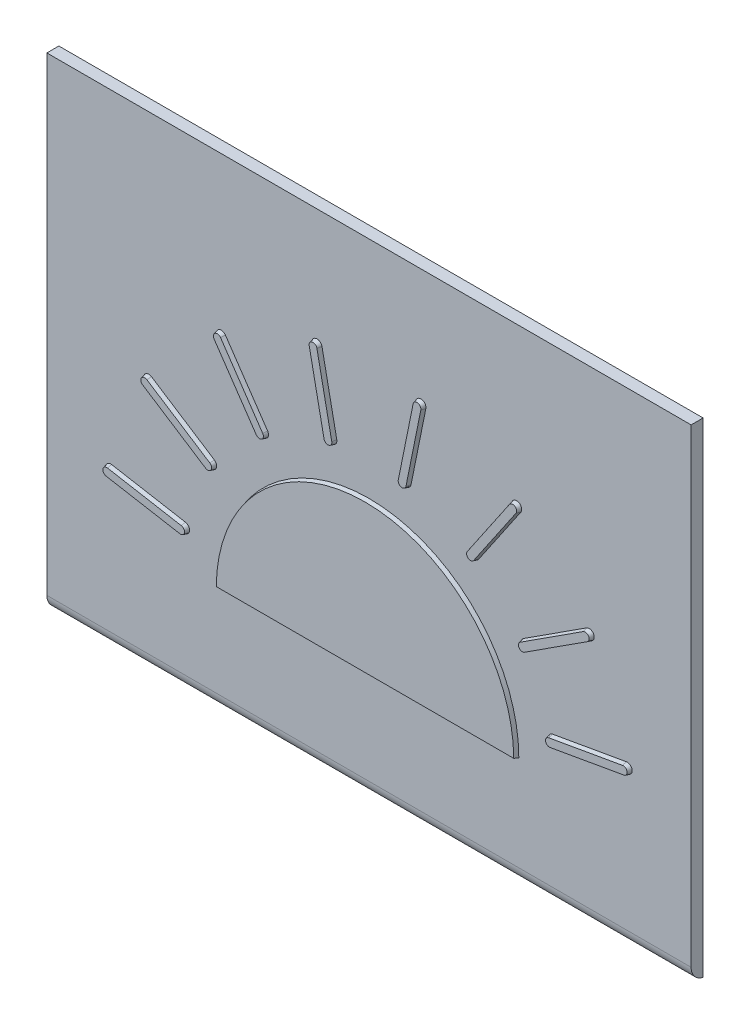
from build123d import *

# Parameters (mm, degrees)
SKETCH1_W                     = 129
SKETCH1_H                     = 97
BOSS_EXTRUDE1_DEPTH           = 2.4
FILLET1_R                     = 3
BOSS_EXTRUDE2_DEPTH           = 0.8
BOSS_EXTRUDE2_DRAFT           = 15
BOSS_EXTRUDE2_PROFILE_2_DEPTH = 0.8
BOSS_EXTRUDE2_PROFILE_2_DRAFT = 15
BOSS_EXTRUDE2_PROFILE_3_DEPTH = 0.8
BOSS_EXTRUDE2_PROFILE_3_DRAFT = 15
BOSS_EXTRUDE2_PROFILE_4_DEPTH = 0.8
BOSS_EXTRUDE2_PROFILE_4_DRAFT = 15
BOSS_EXTRUDE2_PROFILE_5_DEPTH = 0.8
BOSS_EXTRUDE2_PROFILE_5_DRAFT = 15
BOSS_EXTRUDE2_PROFILE_6_DEPTH = 0.8
BOSS_EXTRUDE2_PROFILE_6_DRAFT = 15
BOSS_EXTRUDE2_PROFILE_7_DEPTH = 0.8
BOSS_EXTRUDE2_PROFILE_7_DRAFT = 15
BOSS_EXTRUDE2_PROFILE_8_DEPTH = 0.8
BOSS_EXTRUDE2_PROFILE_8_DRAFT = 15
BOSS_EXTRUDE2_PROFILE_9_DEPTH = 0.8
BOSS_EXTRUDE2_PROFILE_9_DRAFT = 15


with BuildPart() as part:
    # Sketch1 → Boss-Extrude1 (new body)
    with BuildSketch(Plane.XY):
        with Locations((64.5, 48.5)):
            Rectangle(SKETCH1_W, SKETCH1_H)
    extrude(amount=BOSS_EXTRUDE1_DEPTH)

    # Fillet1
    # the kernel refuses this fillet: 3 mm, written as the material it takes off along each edge
    with BuildSketch(Plane(origin=(-7.348469228, 0, 2.4), x_dir=(0, 1.5674498735994488e-12, -1.0), z_dir=(1, 0, 0))) as fillet1_piece_1:
        with BuildLine():
            CenterArc((3, 2.939387691), FILLET1_R, 180, 78.463040967)
            Line((0, 2.939387691), (-0.06, 2.939387691))
            Line((-0.06, 2.939387691), (-0.06, 0))
            Line((-0.06, 0), (0, -0.06))
            ThreePointArc((0, -0.06), (1.2, -0.06), (2.388, -0.058787754))
            Line((2.388, -0.058787754), (2.4, 0))
        make_face()
    extrude(amount=143.696938457, mode=Mode.SUBTRACT)


with BuildPart() as boss_extrude2_tool:
    # Sketch2 → Boss-Extrude2 (with draft: the straight prism first)
    with BuildSketch(Plane.XY.offset(2.4)):
        with BuildLine():
            Line((34.5, 22), (94.5, 22))
            ThreePointArc((94.5, 22), (64.5, 52), (34.5, 22))
        make_face()
    extrude(amount=BOSS_EXTRUDE2_DEPTH)
    # Boss-Extrude2: the draft: its side faces are tilted about the plane it starts from
    boss_extrude2_sides = [boss_extrude2_tool.faces().sort_by_distance(p)[0] for p in [
        (64.5, 22, 2.8),
        (64.5, 52, 2.8),
    ]]
    draft(boss_extrude2_sides, Plane.XY.offset(2.4), BOSS_EXTRUDE2_DRAFT)


with BuildPart() as part_1:
    add(part.part)

    # Boss-Extrude2: add boss_extrude2_tool
    add(boss_extrude2_tool.part)


with BuildPart() as boss_extrude2_profile_2_tool:
    # Sketch2 → Boss-Extrude2 profile 2 (with draft: the straight prism first)
    with BuildSketch(Plane.XY.offset(2.4)):
        with BuildLine():
            ThreePointArc((12.971241145, 32.101337081), (11.812785214, 31.290177505), (12.623944789, 30.131721575))
            Line((12.623944789, 30.131721575), (27.396061084, 27.526998909))
            ThreePointArc((27.396061084, 27.526998909), (28.554517015, 28.338158485), (27.74335744, 29.496614416))
            Line((27.74335744, 29.496614416), (12.971241145, 32.101337081))
        make_face()
    extrude(amount=BOSS_EXTRUDE2_PROFILE_2_DEPTH)
    # Boss-Extrude2 profile 2: the draft: its side faces are tilted about the plane it starts from
    boss_extrude2_profile_2_sides = [boss_extrude2_profile_2_tool.faces().sort_by_distance(p)[0] for p in [
        (11.812785214, 31.290177505, 2.8),
        (20.010002937, 28.829360242, 2.8),
        (28.554517015, 28.338158485, 2.8),
        (20.357299292, 30.798975748, 2.8),
    ]]
    draft(boss_extrude2_profile_2_sides, Plane.XY.offset(2.4), BOSS_EXTRUDE2_PROFILE_2_DRAFT)


with BuildPart() as part_2:
    add(part_1.part)

    # Boss-Extrude2 profile 2: add boss_extrude2_profile_2_tool
    add(boss_extrude2_profile_2_tool.part)


with BuildPart() as boss_extrude2_profile_3_tool:
    # Sketch2 → Boss-Extrude2 profile 3 (with draft: the straight prism first)
    with BuildSketch(Plane.XY.offset(2.4)):
        with BuildLine():
            ThreePointArc((20.941185298, 51.323704776), (19.558613111, 51.026225117), (19.856092771, 49.64365293))
            Line((19.856092771, 49.64365293), (32.456481618, 41.505458972))
            ThreePointArc((32.456481618, 41.505458972), (33.839053805, 41.802938631), (33.541574146, 43.185510818))
            Line((33.541574146, 43.185510818), (20.941185298, 51.323704776))
        make_face()
    extrude(amount=BOSS_EXTRUDE2_PROFILE_3_DEPTH)
    # Boss-Extrude2 profile 3: the draft: its side faces are tilted about the plane it starts from
    boss_extrude2_profile_3_sides = [boss_extrude2_profile_3_tool.faces().sort_by_distance(p)[0] for p in [
        (33.839053805, 41.802938631, 2.8),
        (27.241379722, 47.254607797, 2.8),
        (19.558613111, 51.026225117, 2.8),
        (26.156287194, 45.574555951, 2.8),
    ]]
    draft(boss_extrude2_profile_3_sides, Plane.XY.offset(2.4), BOSS_EXTRUDE2_PROFILE_3_DRAFT)


with BuildPart() as part_3:
    add(part_2.part)

    # Boss-Extrude2 profile 3: add boss_extrude2_profile_3_tool
    add(boss_extrude2_profile_3_tool.part)


with BuildPart() as boss_extrude2_profile_4_tool:
    # Sketch2 → Boss-Extrude2 profile 4 (with draft: the straight prism first)
    with BuildSketch(Plane.XY.offset(2.4)):
        with BuildLine():
            ThreePointArc((35.751935726, 65.94085571), (34.362376894, 66.203774426), (34.099458177, 64.814215594))
            Line((34.099458177, 64.814215594), (42.549259048, 52.420633979))
            ThreePointArc((42.549259048, 52.420633979), (43.938817881, 52.157715263), (44.201736597, 53.547274095))
            Line((44.201736597, 53.547274095), (35.751935726, 65.94085571))
        make_face()
    extrude(amount=BOSS_EXTRUDE2_PROFILE_4_DEPTH)
    # Boss-Extrude2 profile 4: the draft: its side faces are tilted about the plane it starts from
    boss_extrude2_profile_4_sides = [boss_extrude2_profile_4_tool.faces().sort_by_distance(p)[0] for p in [
        (38.324358613, 58.617424786, 2.8),
        (43.938817881, 52.157715263, 2.8),
        (39.976836161, 59.744064902, 2.8),
        (34.362376894, 66.203774426, 2.8),
    ]]
    draft(boss_extrude2_profile_4_sides, Plane.XY.offset(2.4), BOSS_EXTRUDE2_PROFILE_4_DRAFT)


with BuildPart() as part_4:
    add(part_3.part)

    # Boss-Extrude2 profile 4: add boss_extrude2_profile_4_tool
    add(boss_extrude2_profile_4_tool.part)


with BuildPart() as boss_extrude2_profile_5_tool:
    # Sketch2 → Boss-Extrude2 profile 5 (with draft: the straight prism first)
    with BuildSketch(Plane.XY.offset(2.4)):
        with BuildLine():
            ThreePointArc((55.07749997, 73.657201755), (53.899181339, 74.4392281), (53.117154994, 73.260909469))
            Line((53.117154994, 73.260909469), (56.089347142, 58.558322151))
            ThreePointArc((56.089347142, 58.558322151), (57.267665773, 57.776295806), (58.049692118, 58.954614438))
            Line((58.049692118, 58.954614438), (55.07749997, 73.657201755))
        make_face()
    extrude(amount=BOSS_EXTRUDE2_PROFILE_5_DEPTH)
    # Boss-Extrude2 profile 5: the draft: its side faces are tilted about the plane it starts from
    boss_extrude2_profile_5_sides = [boss_extrude2_profile_5_tool.faces().sort_by_distance(p)[0] for p in [
        (53.899181339, 74.4392281, 2.8),
        (54.603251068, 65.90961581, 2.8),
        (57.267665773, 57.776295806, 2.8),
        (56.563596044, 66.305908096, 2.8),
    ]]
    draft(boss_extrude2_profile_5_sides, Plane.XY.offset(2.4), BOSS_EXTRUDE2_PROFILE_5_DRAFT)


with BuildPart() as part_5:
    add(part_4.part)

    # Boss-Extrude2 profile 5: add boss_extrude2_profile_5_tool
    add(boss_extrude2_profile_5_tool.part)


with BuildPart() as boss_extrude2_profile_6_tool:
    # Sketch2 → Boss-Extrude2 profile 6 (with draft: the straight prism first)
    with BuildSketch(Plane.XY.offset(2.4)):
        with BuildLine():
            ThreePointArc((75.882845006, 73.260909469), (75.100818661, 74.4392281), (73.92250003, 73.657201755))
            Line((73.92250003, 73.657201755), (70.950307882, 58.954614438))
            ThreePointArc((70.950307882, 58.954614438), (71.732334227, 57.776295806), (72.910652858, 58.558322151))
            Line((72.910652858, 58.558322151), (75.882845006, 73.260909469))
        make_face()
    extrude(amount=BOSS_EXTRUDE2_PROFILE_6_DEPTH)
    # Boss-Extrude2 profile 6: the draft: its side faces are tilted about the plane it starts from
    boss_extrude2_profile_6_sides = [boss_extrude2_profile_6_tool.faces().sort_by_distance(p)[0] for p in [
        (75.100818661, 74.4392281, 2.8),
        (72.436403956, 66.305908096, 2.8),
        (71.732334227, 57.776295806, 2.8),
        (74.396748932, 65.90961581, 2.8),
    ]]
    draft(boss_extrude2_profile_6_sides, Plane.XY.offset(2.4), BOSS_EXTRUDE2_PROFILE_6_DRAFT)


with BuildPart() as part_6:
    add(part_5.part)

    # Boss-Extrude2 profile 6: add boss_extrude2_profile_6_tool
    add(boss_extrude2_profile_6_tool.part)


with BuildPart() as boss_extrude2_profile_7_tool:
    # Sketch2 → Boss-Extrude2 profile 7 (with draft: the straight prism first)
    with BuildSketch(Plane.XY.offset(2.4)):
        with BuildLine():
            ThreePointArc((94.900541823, 64.814215594), (94.637623106, 66.203774426), (93.248064274, 65.94085571))
            Line((93.248064274, 65.94085571), (84.798263403, 53.547274095))
            ThreePointArc((84.798263403, 53.547274095), (85.061182119, 52.157715263), (86.450740952, 52.420633979))
            Line((86.450740952, 52.420633979), (94.900541823, 64.814215594))
        make_face()
    extrude(amount=BOSS_EXTRUDE2_PROFILE_7_DEPTH)
    # Boss-Extrude2 profile 7: the draft: its side faces are tilted about the plane it starts from
    boss_extrude2_profile_7_sides = [boss_extrude2_profile_7_tool.faces().sort_by_distance(p)[0] for p in [
        (94.637623106, 66.203774426, 2.8),
        (89.023163839, 59.744064902, 2.8),
        (85.061182119, 52.157715263, 2.8),
        (90.675641387, 58.617424786, 2.8),
    ]]
    draft(boss_extrude2_profile_7_sides, Plane.XY.offset(2.4), BOSS_EXTRUDE2_PROFILE_7_DRAFT)


with BuildPart() as part_7:
    add(part_6.part)

    # Boss-Extrude2 profile 7: add boss_extrude2_profile_7_tool
    add(boss_extrude2_profile_7_tool.part)


with BuildPart() as boss_extrude2_profile_8_tool:
    # Sketch2 → Boss-Extrude2 profile 8 (with draft: the straight prism first)
    with BuildSketch(Plane.XY.offset(2.4)):
        with BuildLine():
            ThreePointArc((109.143907229, 49.64365293), (109.441386889, 51.026225117), (108.058814702, 51.323704776))
            Line((108.058814702, 51.323704776), (95.458425854, 43.185510818))
            ThreePointArc((95.458425854, 43.185510818), (95.160946195, 41.802938631), (96.543518382, 41.505458972))
            Line((96.543518382, 41.505458972), (109.143907229, 49.64365293))
        make_face()
    extrude(amount=BOSS_EXTRUDE2_PROFILE_8_DEPTH)
    # Boss-Extrude2 profile 8: the draft: its side faces are tilted about the plane it starts from
    boss_extrude2_profile_8_sides = [boss_extrude2_profile_8_tool.faces().sort_by_distance(p)[0] for p in [
        (102.843712806, 45.574555951, 2.8),
        (109.441386889, 51.026225117, 2.8),
        (101.758620278, 47.254607797, 2.8),
        (95.160946195, 41.802938631, 2.8),
    ]]
    draft(boss_extrude2_profile_8_sides, Plane.XY.offset(2.4), BOSS_EXTRUDE2_PROFILE_8_DRAFT)


with BuildPart() as part_8:
    add(part_7.part)

    # Boss-Extrude2 profile 8: add boss_extrude2_profile_8_tool
    add(boss_extrude2_profile_8_tool.part)


with BuildPart() as boss_extrude2_profile_9_tool:
    # Sketch2 → Boss-Extrude2 profile 9 (with draft: the straight prism first)
    with BuildSketch(Plane.XY.offset(2.4)):
        with BuildLine():
            ThreePointArc((116.376055211, 30.131721575), (117.187214786, 31.290177505), (116.028758855, 32.101337081))
            Line((116.028758855, 32.101337081), (101.25664256, 29.496614416))
            ThreePointArc((101.25664256, 29.496614416), (100.445482985, 28.338158485), (101.603938916, 27.526998909))
            Line((101.603938916, 27.526998909), (116.376055211, 30.131721575))
        make_face()
    extrude(amount=BOSS_EXTRUDE2_PROFILE_9_DEPTH)
    # Boss-Extrude2 profile 9: the draft: its side faces are tilted about the plane it starts from
    boss_extrude2_profile_9_sides = [boss_extrude2_profile_9_tool.faces().sort_by_distance(p)[0] for p in [
        (108.642700708, 30.798975748, 2.8),
        (100.445482985, 28.338158485, 2.8),
        (108.989997063, 28.829360242, 2.8),
        (117.187214786, 31.290177505, 2.8),
    ]]
    draft(boss_extrude2_profile_9_sides, Plane.XY.offset(2.4), BOSS_EXTRUDE2_PROFILE_9_DRAFT)


with BuildPart() as part_9:
    add(part_8.part)

    # Boss-Extrude2 profile 9: add boss_extrude2_profile_9_tool
    add(boss_extrude2_profile_9_tool.part)


solid = part_9.part
